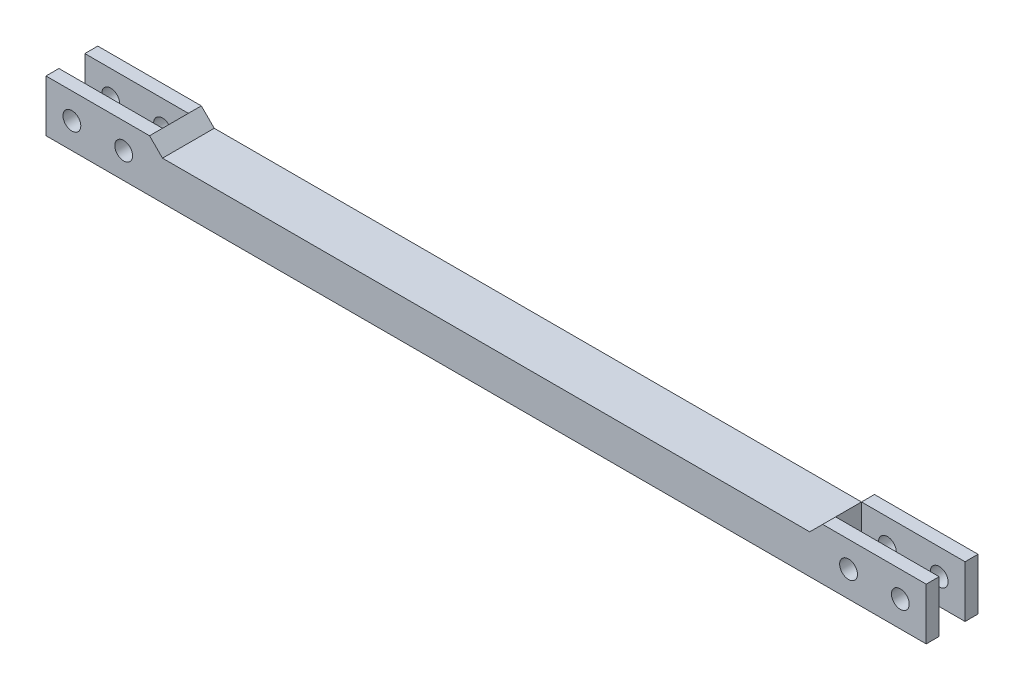
from build123d import *

# Parameters (mm, degrees)
BOSS_EXTRUDE1_DEPTH     = 6.35
CUT_EXTRUDE1_DEPTH      = 109.879819067
CUT_EXTRUDE1_DEPTH_BACK = 109.879819067
SKETCH2_R               = 2.1828125
CUT_EXTRUDE2_DEPTH      = 109.879819067
CUT_EXTRUDE2_DEPTH_BACK = 109.879819067


with BuildPart() as part:
    # Sketch1 → Boss-Extrude1 (new, symmetric)
    with BuildSketch(Plane(origin=(0, 0, 0), x_dir=(1, 0, 0), z_dir=(0, 1, 0))):
        Polygon((-107.95, 0), (107.95, 0), (107.95, 3.175), (82.55, 3.175), (82.55, 9.525), (107.95, 9.525), (107.95, 12.7), (-107.95, 12.7), (-107.95, 9.525), (-82.55, 9.525), (-82.55, 3.175), (-107.95, 3.175), align=None)
    extrude(amount=BOSS_EXTRUDE1_DEPTH, both=True)

    # Sketch2 → Cut-Extrude1 (cut, two sides: drawn at the far end of the back side and taken through both)
    with BuildSketch(Plane.XY.offset(-CUT_EXTRUDE1_DEPTH_BACK)):
        with Locations((-101.6, 0)):
            Circle(SKETCH2_R)
        with Locations((-88.9, 0)):
            Circle(SKETCH2_R)
        with Locations((101.6, 0)):
            Circle(SKETCH2_R)
        with Locations((88.9, 0)):
            Circle(SKETCH2_R)
    extrude(amount=CUT_EXTRUDE1_DEPTH + CUT_EXTRUDE1_DEPTH_BACK, mode=Mode.SUBTRACT)

    # Sketch3 → Cut-Extrude2 (cut, two sides: drawn at the far end of the back side and taken through both)
    with BuildSketch(Plane.XY.offset(-CUT_EXTRUDE2_DEPTH_BACK)):
        Polygon((-82.55, 6.35), (-79.375, 3.175), (79.375, 3.175), (82.55, 6.35), align=None)
    extrude(amount=CUT_EXTRUDE2_DEPTH + CUT_EXTRUDE2_DEPTH_BACK, mode=Mode.SUBTRACT)


solid = part.part
